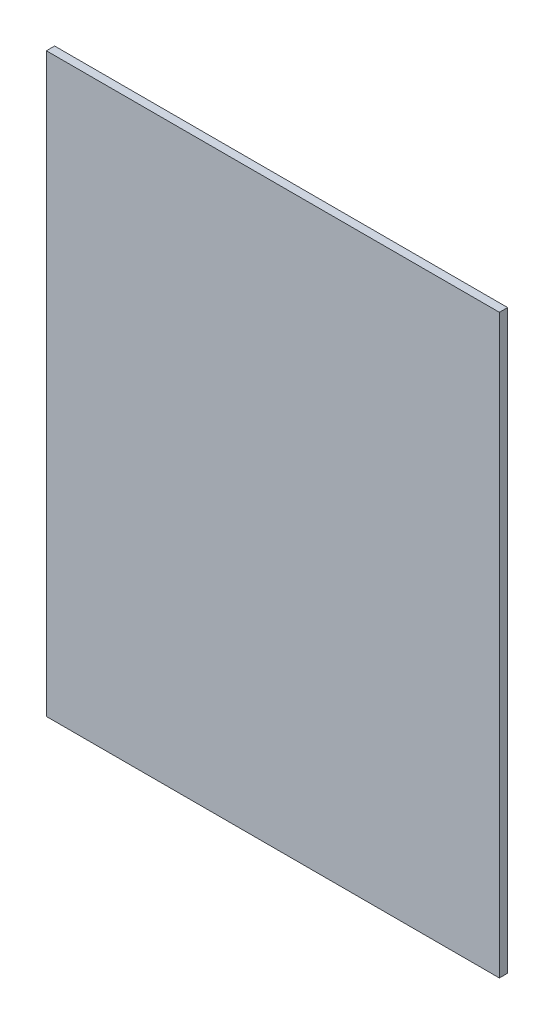
from build123d import *

# Parameters (mm, degrees)
SKETCH1_W           = 110
SKETCH1_H           = 140
BOSS_EXTRUDE1_DEPTH = 1


with BuildPart() as part:
    # Sketch1 → Boss-Extrude1 (new, symmetric)
    with BuildSketch(Plane.XY):
        Rectangle(SKETCH1_W, SKETCH1_H)
    extrude(amount=BOSS_EXTRUDE1_DEPTH, both=True)


solid = part.part
